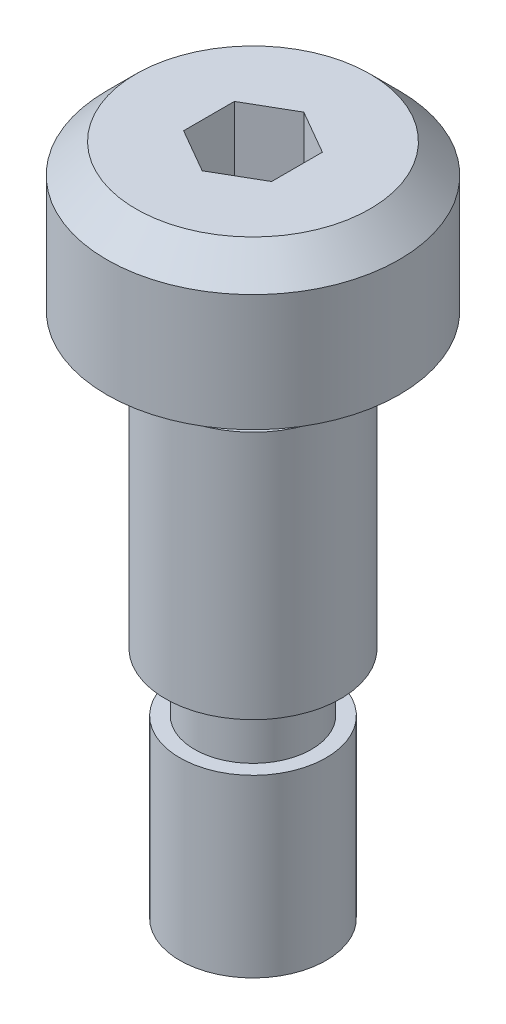
from build123d import *

# Parameters (mm, degrees)
CUT_EXTRUDE1_DEPTH = 3.581396898


with BuildPart() as part:
    # Sketch2 → Base-Revolve (revolve)
    with BuildSketch(Plane.XY):
        Polygon((0, 0), (7.9375, 0), (7.9375, 6.35), (6.35, 7.9375), (0, 7.9375), align=None)
    revolve(axis=Axis((0, 0, 0), (0, 1, 0)))

    # Sketch3 → Boss-Revolve1 (revolve)
    with BuildSketch(Plane.XY):
        Polygon((0, -28.575), (3.96875, -28.575), (3.96875, -19.05), (3.175, -19.05), (3.175, -15.875), (4.7625, -15.875), (4.7625, -2.362197954), (4.445, -2.362197954), (4.445, 0), (0, 0), align=None)
    revolve(axis=Axis((0, 0, 0), (0, 1, 0)))

    # Sketch4 → Cut-Extrude1 (cut)
    with BuildSketch(Plane(origin=(0, 7.9375, 0), x_dir=(-1, 0, 0), z_dir=(0, 1, 0))):
        Polygon((2.387597932, 1.378480068), (6.25e-07, 2.756960497), (-2.387597307, 1.378481151), (-2.387598557, -1.378478985), (-1.876e-06, -2.756960497), (2.387596681, -1.378482234), align=None)
    extrude(amount=-CUT_EXTRUDE1_DEPTH, mode=Mode.SUBTRACT)


solid = part.part
